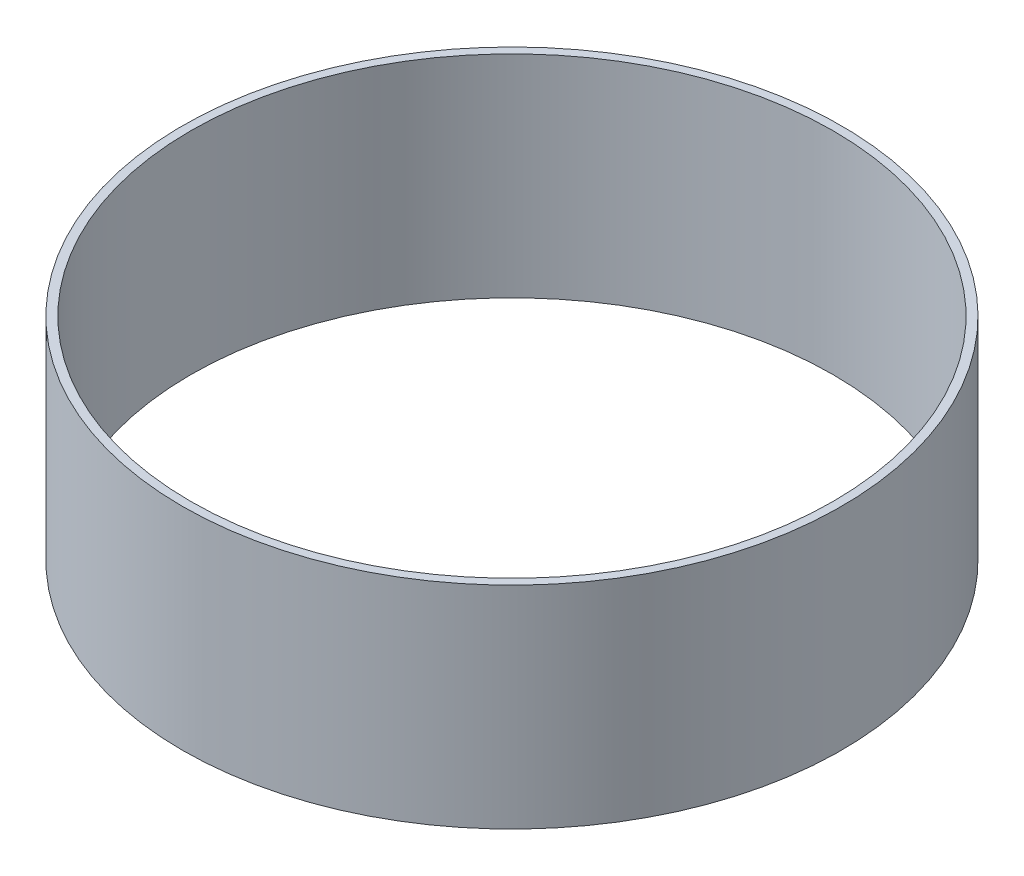
from build123d import *

# Parameters (mm, degrees)
BOSS_EXTRUDE1_DEPTH      = 25
BOSS_EXTRUDE1_DEPTH_BACK = 25
SKETCH1_R                = 78
SKETCH1_R_2              = 76


with BuildPart() as part:
    # Sketch1 → Boss-Extrude1 (new, two sides: drawn at the far end of the back side and taken through both)
    with BuildSketch(Plane(origin=(0, 0, 0), x_dir=(1, 0, 0), z_dir=(0, 1, 0)).offset(-BOSS_EXTRUDE1_DEPTH_BACK)):
        Circle(SKETCH1_R)
        Circle(SKETCH1_R_2, mode=Mode.SUBTRACT)
    extrude(amount=BOSS_EXTRUDE1_DEPTH + BOSS_EXTRUDE1_DEPTH_BACK)


solid = part.part
